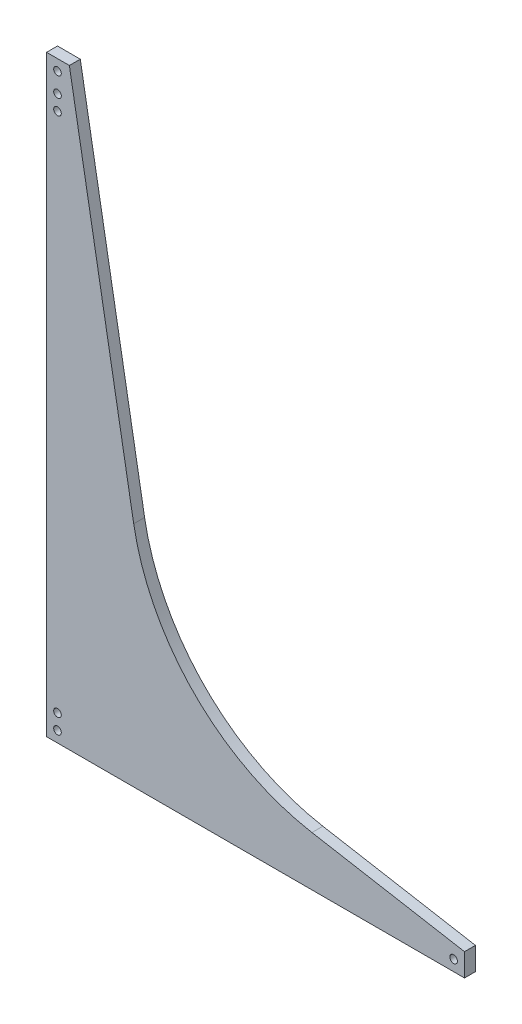
from build123d import *

# Parameters (mm, degrees)
BOSS_EXTRUDE1_DEPTH = 9.128125
SKETCH2_R           = 6.35
CUT_EXTRUDE1_DEPTH  = 1213.239209341


with BuildPart() as part:
    # Sketch1 → Boss-Extrude1 (new, symmetric)
    with BuildSketch(Plane.XY):
        with BuildLine():
            Line((0, 0), (698.5, 0))
            Line((698.5, 0), (698.5, 38.1))
            Line((698.5, 38.1), (443.531016385, 83.057911055))
            ThreePointArc((443.531016385, 83.057911055), (247.589582012, 185.058565627), (145.58892744, 381))
            Line((145.58892744, 381), (38.1, 990.6))
            Line((38.1, 990.6), (0, 990.6))
            Line((0, 990.6), (0, 0))
        make_face()
    extrude(amount=BOSS_EXTRUDE1_DEPTH, both=True)

    # Sketch2 → Cut-Extrude1 (cut, through all)
    with BuildSketch(Plane.XY.offset(9.128125)):
        with Locations((18.25625, 972.34375)):
            Circle(SKETCH2_R)
        with Locations((18.25625, 18.25625)):
            Circle(SKETCH2_R)
        with Locations((680.24375, 18.25625)):
            Circle(SKETCH2_R)
        with Locations((18.25625, 43.65625)):
            Circle(SKETCH2_R)
        with Locations((18.25625, 939.8)):
            Circle(SKETCH2_R)
        with Locations((18.25625, 914.4)):
            Circle(SKETCH2_R)
    extrude(amount=-CUT_EXTRUDE1_DEPTH, mode=Mode.SUBTRACT)


solid = part.part
